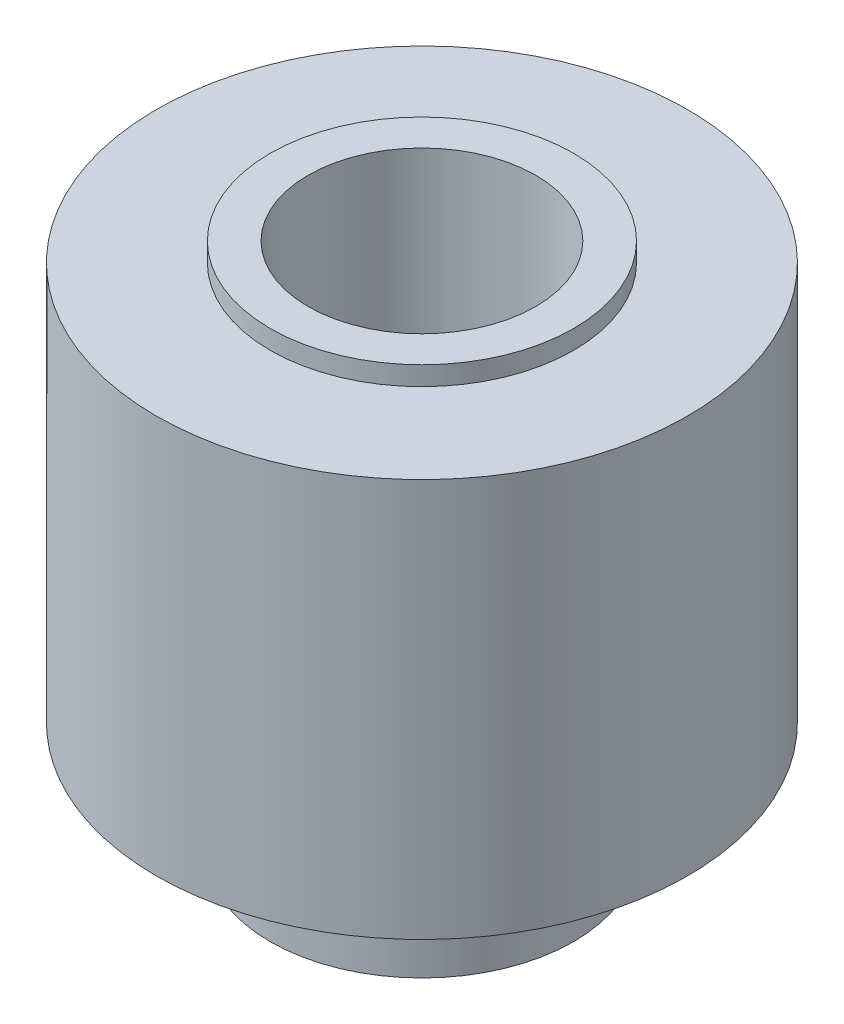
from build123d import *

# Parameters (mm, degrees)
SKETCH1_R           = 7
SKETCH1_R_2         = 3
BOSS_EXTRUDE1_DEPTH = 14
SKETCH2_W           = 3
SKETCH2_H           = 3
SKETCH2_H_2         = 0.5


with BuildPart() as part:
    # Sketch1 → Boss-Extrude1 (new body)
    with BuildSketch(Plane(origin=(0, 0, 0), x_dir=(1, 0, 0), z_dir=(0, 1, 0))):
        Circle(SKETCH1_R)
        Circle(SKETCH1_R_2, mode=Mode.SUBTRACT)
    extrude(amount=BOSS_EXTRUDE1_DEPTH)

    # Sketch2 → Cut-Revolve1 (revolve, cut)
    with BuildSketch(Plane.XY):
        with Locations((5.5, 1.5)):
            Rectangle(SKETCH2_W, SKETCH2_H)
        with Locations((5.5, 13.75)):
            Rectangle(SKETCH2_W, SKETCH2_H_2)
    revolve(axis=Axis((0, 14, 0), (0, -1, 0)), mode=Mode.SUBTRACT)


solid = part.part
